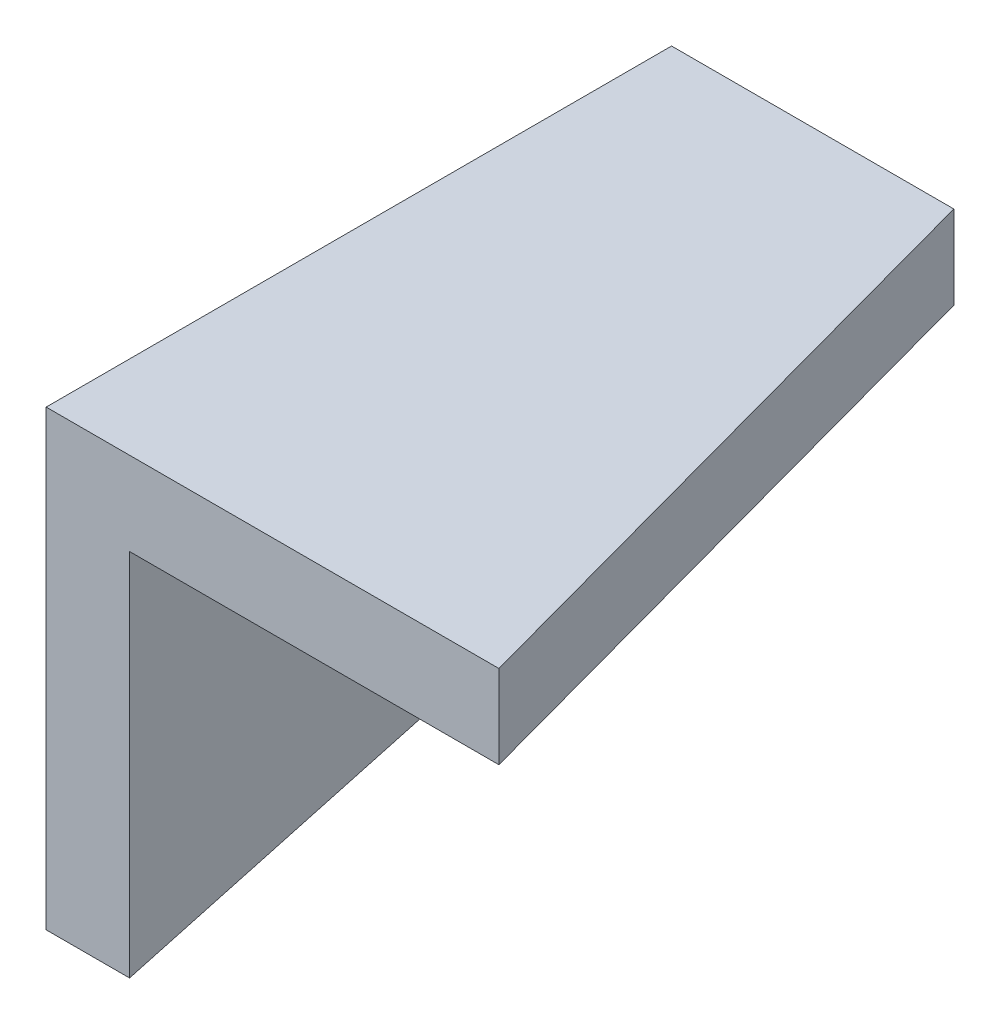
from build123d import *

# Parameters (mm, degrees)
BOSS_EXTRUDE1_DEPTH = 30
CUT_EXTRUDE1_DEPTH  = 10
CUT_EXTRUDE2_DEPTH  = 81.347178722


with BuildPart() as part:
    # Sketch1 → Boss-Extrude1 (new, symmetric)
    with BuildSketch(Plane.XY):
        Polygon((40, 0), (0, 0), (0, -40), (-8, -40), (-8, 8), (40, 8), align=None)
    extrude(amount=BOSS_EXTRUDE1_DEPTH, both=True)

    # Sketch2 → Cut-Extrude1 (cut)
    with BuildSketch(Plane.XZ):
        Polygon((35.435421948, 30), (19.080611818, -30), (40, -30), (40, 30), align=None)
    extrude(amount=-CUT_EXTRUDE1_DEPTH, mode=Mode.SUBTRACT)

    # Sketch4 → Cut-Extrude2 (cut, through all)
    with BuildSketch(Plane(origin=(0, 0, -30), x_dir=(-1, 0, 0), z_dir=(0, 0, -1))):
        Polygon((0, 0), (8, 8), (8, -40), (0, -40), align=None)
    extrude(amount=-CUT_EXTRUDE2_DEPTH, mode=Mode.SUBTRACT)

    # Mirror1: part across plane


with BuildPart() as part_1:
    add(part.part)
    add(part.part.mirror(Plane(origin=(0, 0, 30), x_dir=(0, 0, 1), z_dir=(0.7071067811865476, 0.7071067811865476, 0))))


solid = part_1.part
